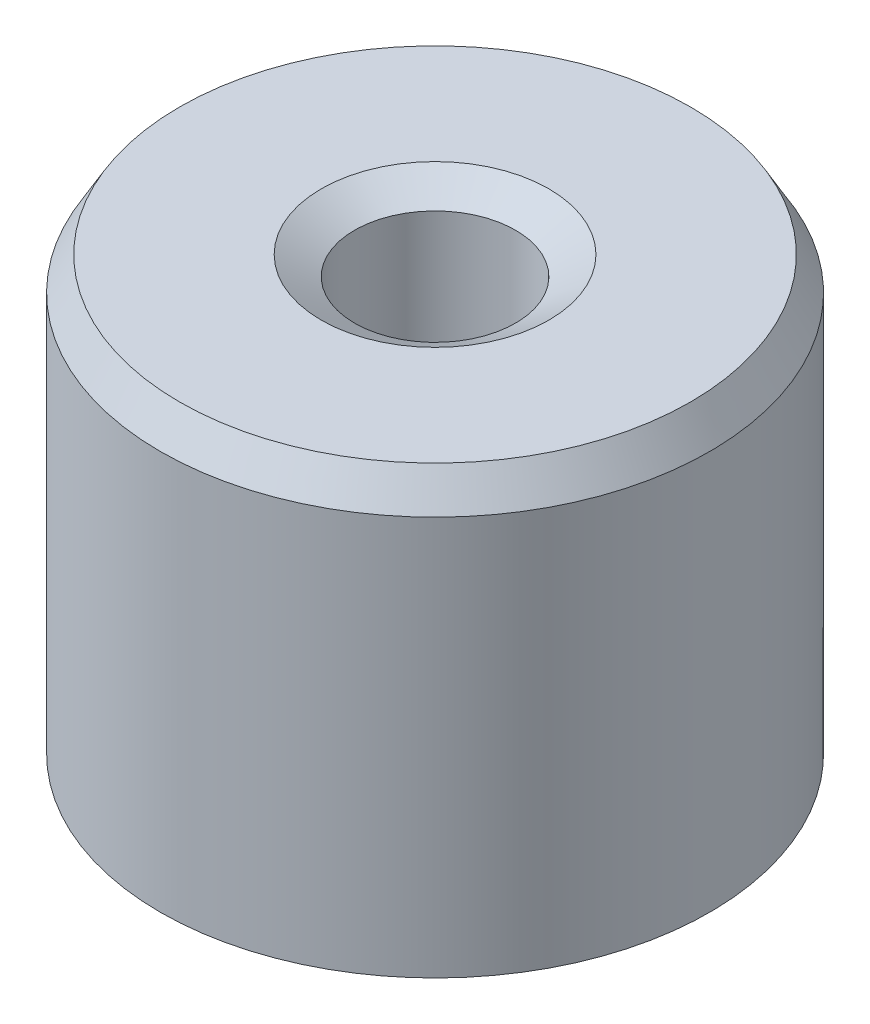
from build123d import *
from OCP.BRepFilletAPI import BRepFilletAPI_MakeChamfer

# Parameters (mm, degrees)
SKETCH1_R           = 5
BOSS_EXTRUDE1_DEPTH = 8.218487757
SKETCH2_R           = 1.465458236
CUT_EXTRUDE1_DEPTH  = 11.841749906
CHAMFER1_SIZE       = 0.605576345
CHAMFER1_SIZE2      = 0.349629666


with BuildPart() as part:
    # Sketch1 → Boss-Extrude1 (new body)
    with BuildSketch(Plane(origin=(0, 0, 0), x_dir=(1, 0, 0), z_dir=(0, 1, 0))):
        Circle(SKETCH1_R)
    extrude(amount=BOSS_EXTRUDE1_DEPTH)

    # Sketch2 → Cut-Extrude1 (cut, through all)
    with BuildSketch(Plane(origin=(0, 0, 0), x_dir=(1, 0, 0), z_dir=(0, 1, 0))):
        Circle(SKETCH2_R)
    extrude(amount=CUT_EXTRUDE1_DEPTH, mode=Mode.SUBTRACT)

    # Chamfer1: one chamfer whose edges measure the first distance from different faces: ONE call of the kernel's chamfer builder (chamfer() names one face for all edges)
    chamfer1_edges_1 = [part.edges().sort_by_distance(p)[0] for p in [
        (-1.465458236, 8.218487757, 0),
    ]]
    chamfer1_side_1 = [part.faces().sort_by_distance(p)[0] for p in [
        (-4.858578644, 8.218487757, 0),
    ]]
    chamfer1_edges_2 = [part.edges().sort_by_distance(p)[0] for p in [
        (-1.465458236, 0, 0),
    ]]
    chamfer1_side_2 = [part.faces().sort_by_distance(p)[0] for p in [
        (-1.465458236, 4.109243879, 0),
    ]]
    chamfer1_edges_3 = [part.edges().sort_by_distance(p)[0] for p in [
        (-5, 0, 0),
    ]]
    chamfer1_side_3 = [part.faces().sort_by_distance(p)[0] for p in [
        (-4.858578644, 0, 0),
    ]]
    chamfer1_edges_4 = [part.edges().sort_by_distance(p)[0] for p in [
        (-5, 8.218487757, 0),
    ]]
    chamfer1_side_4 = [part.faces().sort_by_distance(p)[0] for p in [
        (-5, 4.109243879, 0),
    ]]
    chamfer1 = BRepFilletAPI_MakeChamfer(part.part.solid().wrapped)
    for e in chamfer1_edges_1:
        chamfer1.Add(CHAMFER1_SIZE, CHAMFER1_SIZE2, e.wrapped, chamfer1_side_1[0].wrapped)  # the first distance lies on this face
    for e in chamfer1_edges_2:
        chamfer1.Add(CHAMFER1_SIZE, CHAMFER1_SIZE2, e.wrapped, chamfer1_side_2[0].wrapped)  # the first distance lies on this face
    for e in chamfer1_edges_3:
        chamfer1.Add(CHAMFER1_SIZE, CHAMFER1_SIZE2, e.wrapped, chamfer1_side_3[0].wrapped)  # the first distance lies on this face
    for e in chamfer1_edges_4:
        chamfer1.Add(CHAMFER1_SIZE, CHAMFER1_SIZE2, e.wrapped, chamfer1_side_4[0].wrapped)  # the first distance lies on this face
    add(Compound.cast(chamfer1.Shape()), mode=Mode.REPLACE)


solid = part.part
